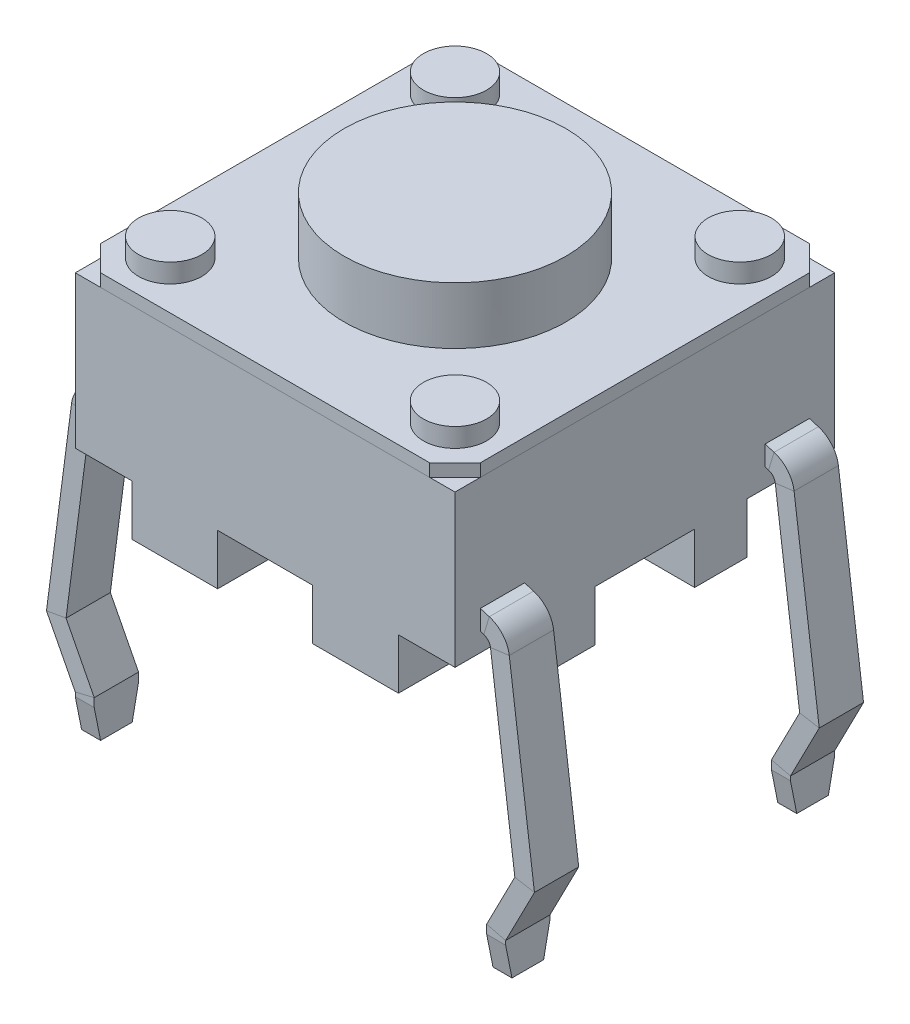
from build123d import *

# Parameters (mm, degrees)
CROQUIS1_W                  = 6
CROQUIS1_H                  = 6
SALIENTE_EXTRUIR1_DEPTH     = 3.4
CROQUIS2_R                  = 1.75
SALIENTE_EXTRUIR2_DEPTH     = 0.9
BARRER6_START               = 1.9
BARRER6_DEPTH               = 0.7
SIMETR_A2_START             = 1.9
SIMETR_A2_COPY_1_DEPTH      = 0.7
CROQUIS3_R                  = 0.5
SALIENTE_EXTRUIR6_DEPTH     = 0.3
SIMETR_A4_COPY_1_SKETCH_R   = 0.5
SIMETR_A4_COPY_1_DEPTH      = 0.3
CORTAR_EXTRUIR1_START       = -0.2
CORTAR_EXTRUIR1_DEPTH       = 9.654133443
SIMETR_A6_START             = -0.2
SIMETR_A6_COPY_1_DEPTH      = 9.654133443
CROQUIS13_W                 = 1.499904498
CROQUIS13_H                 = 1.21
CORTAR_EXTRUIR2_DEPTH       = 0.8
CROQUIS13_3_W               = 0.893400265
CROQUIS13_3_H               = 1.384843815
CROQUIS13_3_W_2             = 0.89
CROQUIS13_3_H_2             = 0.786473886
CORTAR_EXTRUIR3_DEPTH       = 0.8
SIMETR_A9_COPY_1_SKETCH_W   = 0.893400265
SIMETR_A9_COPY_1_SKETCH_H   = 1.384843815
SIMETR_A9_COPY_1_SKETCH_W_2 = 0.89
SIMETR_A9_COPY_1_SKETCH_H_2 = 0.786473886
SIMETR_A9_COPY_1_DEPTH      = 0.8
CORTAR_EXTRUIR4_DEPTH       = 0.3
SIMETR_A11_COPY_1_DEPTH     = 0.3


# Read off the part's stored shape, not the designer's step: Barrer6
with BuildPart() as part:
    # Croquis1 → Saliente-Extruir1 (new body)
    with BuildSketch(Plane(origin=(0, 0, 0), x_dir=(1, 0, 0), z_dir=(0, 1, 0))):
        Rectangle(CROQUIS1_W, CROQUIS1_H)
    extrude(amount=SALIENTE_EXTRUIR1_DEPTH)

    # Croquis2 → Saliente-Extruir2 (add)
    with BuildSketch(Plane(origin=(0, 3.4, 0), x_dir=(1, 0, 0), z_dir=(0, 1, 0))):
        with Locations(Location((0, 0, 0), (0, 0, 90))):
            Circle(CROQUIS2_R)
    extrude(amount=SALIENTE_EXTRUIR2_DEPTH)

    # Barrer6 outline → Barrer6 (add)
    with BuildSketch(Plane.XY.offset(BARRER6_START)):
        with BuildLine():
            Line((3, 1.407087545), (3, 1.0936793))
            Line((3, 1.0936793), (3.054816861, 1.077108111))
            ThreePointArc((3.054816861, 1.077108111), (3.12597159, 1.030446512), (3.160407685, 0.952636129))
            Line((3.160407685, 0.952636129), (3.545582768, -1.998261735))
            Line((3.545582768, -1.998261735), (3.100367019, -2.863770693))
            Line((3.100367019, -2.863770693), (3.100367019, -3.5))
            Line((3.100367019, -3.5), (3.400367019, -3.5))
            Line((3.400367019, -3.5), (3.400367019, -2.936407033))
            Line((3.400367019, -2.936407033), (3.855174739, -2.052251079))
            Line((3.855174739, -2.052251079), (3.457884247, 0.991465178))
            ThreePointArc((3.457884247, 0.991465178), (3.354744065, 1.224516485), (3.141627229, 1.364273499))
            Line((3.141627229, 1.364273499), (3, 1.407087545))
        make_face()
    barrer6 = extrude(amount=BARRER6_DEPTH)

    # Simetría1: Barrer6 across plane
    add(barrer6.mirror(Plane.XY))

    # Simetría2: Barrer6 across plane
    add(barrer6.mirror(Plane(origin=(0, 0, 0), x_dir=(0, 0, 1), z_dir=(1, 0, 0))))

    # Simetría2 copy 1 sketch → Simetría2 copy 1 (add)
    with BuildSketch(Plane(origin=(0, 0, 0), x_dir=(-1, 0, 0), z_dir=(0, 0, -1)).offset(SIMETR_A2_START)):
        with BuildLine():
            Line((3, 1.407087545), (3, 1.0936793))
            Line((3, 1.0936793), (3.054816861, 1.077108111))
            ThreePointArc((3.054816861, 1.077108111), (3.12597159, 1.030446512), (3.160407685, 0.952636129))
            Line((3.160407685, 0.952636129), (3.545582768, -1.998261735))
            Line((3.545582768, -1.998261735), (3.100367019, -2.863770693))
            Line((3.100367019, -2.863770693), (3.100367019, -3.5))
            Line((3.100367019, -3.5), (3.400367019, -3.5))
            Line((3.400367019, -3.5), (3.400367019, -2.936407033))
            Line((3.400367019, -2.936407033), (3.855174739, -2.052251079))
            Line((3.855174739, -2.052251079), (3.457884247, 0.991465178))
            ThreePointArc((3.457884247, 0.991465178), (3.354744065, 1.224516485), (3.141627229, 1.364273499))
            Line((3.141627229, 1.364273499), (3, 1.407087545))
        make_face()
    extrude(amount=SIMETR_A2_COPY_1_DEPTH)

    # Croquis3 → Saliente-Extruir6 (add)
    with BuildSketch(Plane(origin=(0, 3.4, 0), x_dir=(1, 0, 0), z_dir=(0, 1, 0))):
        with Locations(Location((2.25, 2.25, 0), (0, 0, 90))):
            Circle(CROQUIS3_R)
    saliente_extruir6 = extrude(amount=SALIENTE_EXTRUIR6_DEPTH)

    # Simetría3: Saliente-Extruir6 across plane
    add(saliente_extruir6.mirror(Plane(origin=(0, 0, 0), x_dir=(0, 0, 1), z_dir=(1, 0, 0))))

    # Simetría4: Saliente-Extruir6 across plane
    add(saliente_extruir6.mirror(Plane.XY))

    # Simetría4 copy 1 sketch → Simetría4 copy 1 (add)
    with BuildSketch(Plane(origin=(0, 3.4, 0), x_dir=(-1, 0, 0), z_dir=(0, 1, 0))):
        with Locations(Location((2.25, 2.25, 0), (0, 0, 90))):
            Circle(SIMETR_A4_COPY_1_SKETCH_R)
    extrude(amount=SIMETR_A4_COPY_1_DEPTH)

    # Croquis12 → Cortar-Extruir1 (cut)
    with BuildSketch(Plane(origin=(0, 3.4, 0), x_dir=(1, 0, 0), z_dir=(0, 1, 0)).offset(CORTAR_EXTRUIR1_START)):
        Polygon((-22.58932813, -16.98932813), (-3, 2.6), (-2.6, 3), (16.98932813, 22.58932813), (-22.18932813, 61.767984391), (-61.767984391, 22.18932813), align=None)
    cortar_extruir1 = extrude(amount=CORTAR_EXTRUIR1_DEPTH, mode=Mode.SUBTRACT)

    # Simetría5: Cortar-Extruir1 across plane
    add(cortar_extruir1.mirror(Plane.XY), mode=Mode.SUBTRACT)

    # Simetría6: Cortar-Extruir1 across plane
    add(cortar_extruir1.mirror(Plane(origin=(0, 0, 0), x_dir=(0, 0, 1), z_dir=(1, 0, 0))), mode=Mode.SUBTRACT)

    # Simetría6 copy 1 sketch → Simetría6 copy 1 (cut)
    with BuildSketch(Plane(origin=(0, 3.4, 0), x_dir=(-1, 0, 0), z_dir=(0, 1, 0)).offset(SIMETR_A6_START)):
        Polygon((-22.58932813, -16.98932813), (-3, 2.6), (-2.6, 3), (16.98932813, 22.58932813), (-22.18932813, 61.767984391), (-61.767984391, 22.18932813), align=None)
    extrude(amount=SIMETR_A6_COPY_1_DEPTH, mode=Mode.SUBTRACT)


with BuildPart() as body_2:
    # Partir1: the piece on the far side of the plane
    add(part.part)
    split(bisect_by=Plane.ZX.offset(3.2), keep=Keep.BOTTOM)

    # Croquis13 → Cortar-Extruir2 (cut)
    with BuildSketch(Plane.XZ):
        with Locations((0, 2.395)):
            Rectangle(CROQUIS13_W, CROQUIS13_H)
    cortar_extruir2 = extrude(amount=-CORTAR_EXTRUIR2_DEPTH, mode=Mode.SUBTRACT)

    # Simetría7: Cortar-Extruir2 across plane
    add(cortar_extruir2.mirror(Plane.XY), mode=Mode.SUBTRACT)

    # Croquis13<3> → Cortar-Extruir3 (cut)
    with BuildSketch(Plane.XZ):
        with Locations((-2.553299867, 2.307578093)):
            Rectangle(CROQUIS13_3_W, CROQUIS13_3_H)
        with Locations((-2.555, 0.393236943)):
            Rectangle(CROQUIS13_3_W_2, CROQUIS13_3_H_2)
    cortar_extruir3 = extrude(amount=-CORTAR_EXTRUIR3_DEPTH, mode=Mode.SUBTRACT)

    # Simetría8: Cortar-Extruir3 across plane
    add(cortar_extruir3.mirror(Plane.XY), mode=Mode.SUBTRACT)

    # Simetría9: Cortar-Extruir3 across plane
    add(cortar_extruir3.mirror(Plane(origin=(0, 0, 0), x_dir=(0, 0, 1), z_dir=(1, 0, 0))), mode=Mode.SUBTRACT)

    # Simetría9 copy 1 sketch → Simetría9 copy 1 (cut)
    with BuildSketch(Plane(origin=(0, 0, 0), x_dir=(-1, 0, 0), z_dir=(0, -1, 0))):
        with Locations((-2.553299867, 2.307578093)):
            Rectangle(SIMETR_A9_COPY_1_SKETCH_W, SIMETR_A9_COPY_1_SKETCH_H)
        with Locations((-2.555, 0.393236943)):
            Rectangle(SIMETR_A9_COPY_1_SKETCH_W_2, SIMETR_A9_COPY_1_SKETCH_H_2)
    extrude(amount=-SIMETR_A9_COPY_1_DEPTH, mode=Mode.SUBTRACT)

    # Croquis14 → Cortar-Extruir4 (cut)
    with BuildSketch(Plane(origin=(3.400367019, 0, 0), x_dir=(0, 0, -1), z_dir=(1, 0, 0))):
        Polygon((-2.6, -3.5), (-2.5, -3.5), (-2.6, -3.000601878), align=None)
        Polygon((-1.9, -3.000601878), (-2, -3.5), (-1.9, -3.5), align=None)
    cortar_extruir4 = extrude(amount=-CORTAR_EXTRUIR4_DEPTH, mode=Mode.SUBTRACT)

    # Simetría10: Cortar-Extruir4 across plane
    add(cortar_extruir4.mirror(Plane.XY), mode=Mode.SUBTRACT)

    # Simetría11: Cortar-Extruir4 across plane
    add(cortar_extruir4.mirror(Plane(origin=(0, 0, 0), x_dir=(0, 0, 1), z_dir=(1, 0, 0))), mode=Mode.SUBTRACT)

    # Simetría11 copy 1 sketch → Simetría11 copy 1 (cut)
    with BuildSketch(Plane.ZY.offset(3.400367019)):
        Polygon((-2.6, -3.5), (-2.5, -3.5), (-2.6, -3.000601878), align=None)
        Polygon((-1.9, -3.000601878), (-2, -3.5), (-1.9, -3.5), align=None)
    extrude(amount=-SIMETR_A11_COPY_1_DEPTH, mode=Mode.SUBTRACT)


with BuildPart() as part_1:
    add(part.part)

    # Partir1
    split(bisect_by=Plane.ZX.offset(3.2), keep=Keep.TOP)


solid = Compound([body_2.part, part_1.part])
